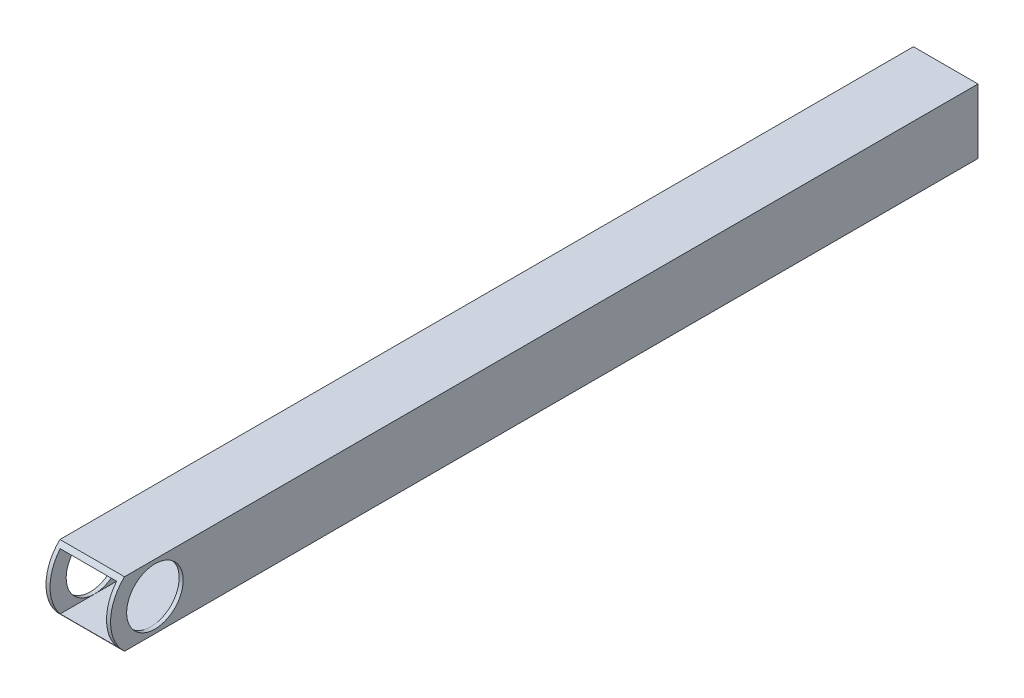
from build123d import *

# Parameters (mm, degrees)
SKETCH1_W           = 25.4
SKETCH1_H           = 25.4
SKETCH1_W_2         = 22.225
SKETCH1_H_2         = 22.225
EXTRUDE_THIN1_DEPTH = 342.9
SKETCH2_R           = 11.1125
CUT_EXTRUDE1_DEPTH  = 345.073916477
CUT_EXTRUDE2_DEPTH  = 345.073916477


with BuildPart() as part:
    # Sketch1 → Extrude-Thin1 (new body)
    with BuildSketch(Plane.XY):
        Rectangle(SKETCH1_W, SKETCH1_H)
        Rectangle(SKETCH1_W_2, SKETCH1_H_2, mode=Mode.SUBTRACT)
    extrude(amount=EXTRUDE_THIN1_DEPTH)

    # Sketch2 → Cut-Extrude1 (cut, through all)
    with BuildSketch(Plane(origin=(12.7, 0, 0), x_dir=(0, 0, -1), z_dir=(1, 0, 0))):
        with Locations((-323.85, 0)):
            Circle(SKETCH2_R)
    extrude(amount=-CUT_EXTRUDE1_DEPTH, mode=Mode.SUBTRACT)

    # Sketch3 → Cut-Extrude2 (cut, through all)
    with BuildSketch(Plane(origin=(12.7, 0, 0), x_dir=(0, 0, -1), z_dir=(1, 0, 0))):
        with BuildLine():
            Line((-335.835362166, 12.7), (-342.9, 12.7))
            Line((-342.9, 12.7), (-342.9, -12.7))
            Line((-342.9, -12.7), (-335.835362166, -12.7))
            ThreePointArc((-335.835362166, -12.7), (-341.3125, 0), (-335.835362166, 12.7))
        make_face()
    extrude(amount=-CUT_EXTRUDE2_DEPTH, mode=Mode.SUBTRACT)


solid = part.part
